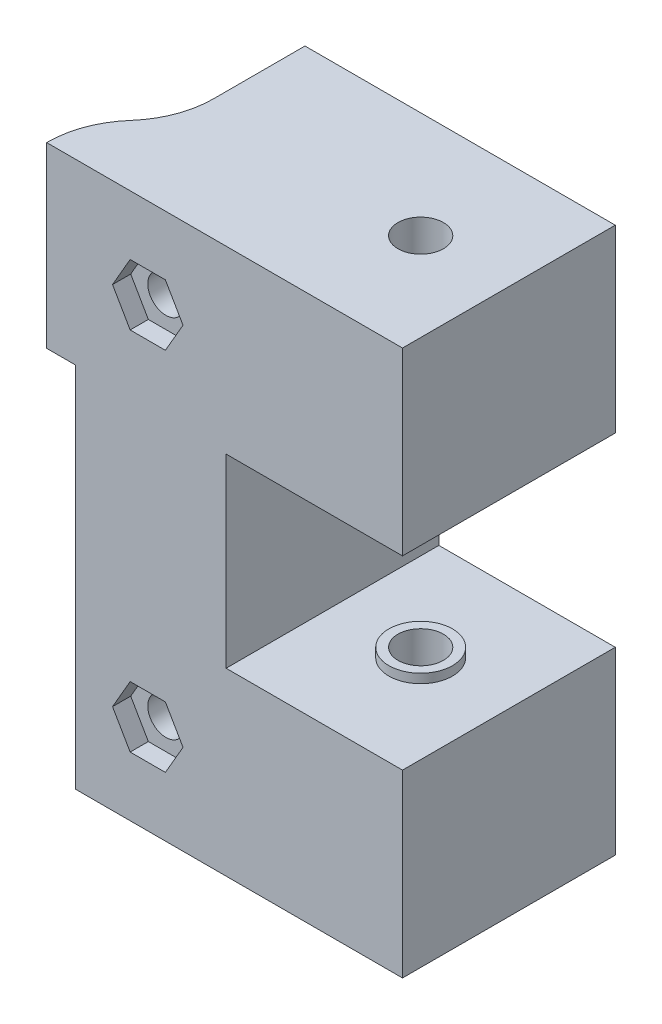
from build123d import *

# Parameters (mm, degrees)
MAINBLOCK_R                      = 2
MAINBLOCKBOSS_EXTRUDE1_DEPTH     = 23.4
TOPHOLECUT_SKETCH2_R             = 2.5
TOPHOLECUT_EXTRUDE1_DEPTH        = 45
MOUNTHOLEBORECUT_EXTRUDE2_DEPTH  = 2
TOPSPACERSKETCH4_R               = 3.5
TOPSPACERSKETCH4_R_2             = 2.5
TOPSPACERBOSS_EXTRUDE2_DEPTH     = 1
LOWERSPACERBOSS_EXTRUDE3_START   = 1
LOWERSPACERSKETCH5_R             = 3.5
LOWERSPACERSKETCH5_R_2           = 2.5
LOWERSPACERBOSS_EXTRUDE3_DEPTH   = 1
PUSHPINHOLESKETCH1_R             = 1
PUSHPINHOLECUT_EXTRUDE1_DEPTH    = 76.354665582
SCREWCOLLISIONSKETCH2_W          = 18.72
SCREWCOLLISIONSKETCH2_H          = 60
SCREWCOLLISIONCUT_EXTRUDE2_DEPTH = 5
SCREWCOLLISIONFILLET1_R          = 10
SCREWCOLLISIONFILLET2_R          = 10
MIDRAILINDENTSKETCH1_W           = 3.175
MIDRAILINDENTSKETCH1_H           = 40.4
MIDRAILINDENTCUT_EXTRUDE1_DEPTH  = 76.354665582


with BuildPart() as part:
    # MainBlock → MainBlockBoss-Extrude1 (new body)
    with BuildSketch(Plane.XY):
        Polygon((0, 0), (39.125, 0), (39.125, 19.8), (19.725, 19.8), (19.725, 40.2), (39.125, 40.2), (39.125, 60), (0, 60), align=None)
        with Locations((11.1125, 50.1)):
            Circle(MAINBLOCK_R, mode=Mode.SUBTRACT)
        with Locations((11.1125, 9.9)):
            Circle(MAINBLOCK_R, mode=Mode.SUBTRACT)
    extrude(amount=MAINBLOCKBOSS_EXTRUDE1_DEPTH)

    # TopHoleCut-Sketch2 → TopHoleCut-Extrude1 (cut)
    with BuildSketch(Plane(origin=(0, 60, 0), x_dir=(1, 0, 0), z_dir=(0, 1, 0))):
        with Locations(Location((29.425, -11.7, 0), (0, 0, 270))):
            Circle(TOPHOLECUT_SKETCH2_R)
    extrude(amount=-TOPHOLECUT_EXTRUDE1_DEPTH, mode=Mode.SUBTRACT)

    # MountHoleBoreSketch3 → MountHoleBoreCut-Extrude2 (cut)
    with BuildSketch(Plane.XY.offset(23.4)):
        Polygon((14.9875, 50.1), (13.05, 53.45584844), (9.175, 53.45584844), (7.2375, 50.1), (9.175, 46.74415156), (13.05, 46.74415156), align=None)
        Polygon((14.9875, 9.9), (13.05, 13.25584844), (9.175, 13.25584844), (7.2375, 9.9), (9.175, 6.54415156), (13.05, 6.54415156), align=None)
    extrude(amount=-MOUNTHOLEBORECUT_EXTRUDE2_DEPTH, mode=Mode.SUBTRACT)

    # TopSpacerSketch4 → TopSpacerBoss-Extrude2 (add)
    with BuildSketch(Plane.XZ.offset(-40.2)):
        with Locations(Location((29.425, 11.7, 0), (0, 0, 90))):
            Circle(TOPSPACERSKETCH4_R)
        with Locations(Location((29.425, 11.7, 0), (0, 0, 90))):
            Circle(TOPSPACERSKETCH4_R_2, mode=Mode.SUBTRACT)
    extrude(amount=TOPSPACERBOSS_EXTRUDE2_DEPTH)

    # LowerSpacerSketch5 → LowerSpacerBoss-Extrude3 (add)
    with BuildSketch(Plane(origin=(0, 19.8, 0), x_dir=(1, 0, 0), z_dir=(0, 1, 0)).offset(LOWERSPACERBOSS_EXTRUDE3_START)):
        with Locations(Location((29.425, -11.7, 0), (0, 0, 270))):
            Circle(LOWERSPACERSKETCH5_R)
        with Locations(Location((29.425, -11.7, 0), (0, 0, 270))):
            Circle(LOWERSPACERSKETCH5_R_2, mode=Mode.SUBTRACT)
    extrude(amount=-LOWERSPACERBOSS_EXTRUDE3_DEPTH)

    # PushPinHoleSketch1 → PushPinHoleCut-Extrude1 (cut, through all)
    with BuildSketch(Plane.XZ):
        with Locations(Location((29.425, 11.7, 0), (0, 0, 270))):
            Circle(PUSHPINHOLESKETCH1_R)
    extrude(amount=-PUSHPINHOLECUT_EXTRUDE1_DEPTH, mode=Mode.SUBTRACT)

    # ScrewCollisionSketch2 → ScrewCollisionCut-Extrude2 (cut)
    with BuildSketch(Plane.ZY):
        with Locations((9.36, 30)):
            Rectangle(SCREWCOLLISIONSKETCH2_W, SCREWCOLLISIONSKETCH2_H)
    extrude(amount=-SCREWCOLLISIONCUT_EXTRUDE2_DEPTH, mode=Mode.SUBTRACT)

    # ScrewCollisionFillet1
    # the kernel refuses this fillet: 10 mm, written as the material it adds along each edge
    with BuildSketch(Plane(origin=(5, 60, 18.72), x_dir=(-1, 0, 0), z_dir=(0, -1, 0))) as screwcollisionfillet1_piece_1:
        with BuildLine():
            CenterArc((10, 8.660254038), SCREWCOLLISIONFILLET1_R, 180, 60)
            Line((0, 8.660254038), (-0.2, 8.660254038))
            Line((-0.2, 8.660254038), (-0.2, 0))
            Line((-0.2, 0), (0, -0.2))
            ThreePointArc((0, -0.2), (2.5, -0.2), (4.9, -0.173205081))
            Line((4.9, -0.173205081), (5, 0))
        make_face()
    extrude(amount=60)

    # ScrewCollisionFillet2
    screwcollisionfillet2_edges = [part.edges().sort_by_distance(p)[0] for p in [
        (0, 30, 18.72),
    ]]
    fillet(screwcollisionfillet2_edges, radius=SCREWCOLLISIONFILLET2_R)

    # MidRailIndentSketch1 → MidRailIndentCut-Extrude1 (cut, through all)
    with BuildSketch(Plane.XY.offset(23.4)):
        with Locations((1.5875, 20.2)):
            Rectangle(MIDRAILINDENTSKETCH1_W, MIDRAILINDENTSKETCH1_H)
    extrude(amount=-MIDRAILINDENTCUT_EXTRUDE1_DEPTH, mode=Mode.SUBTRACT)


solid = part.part
